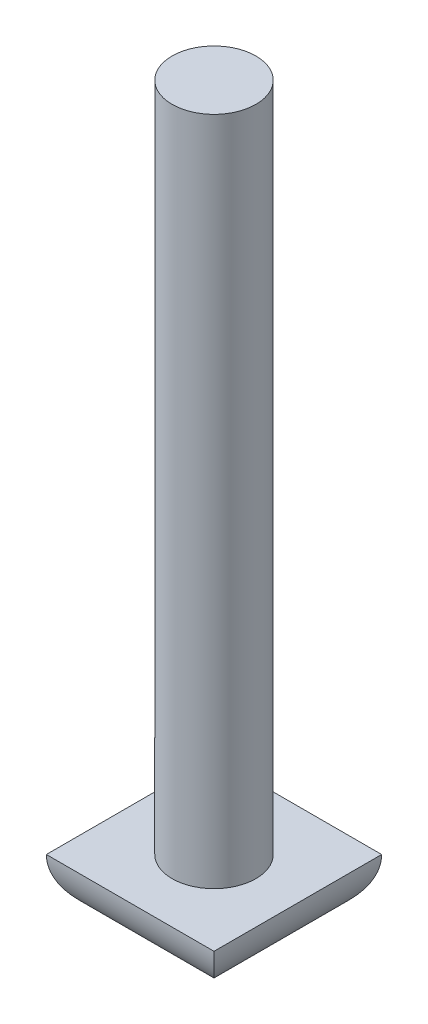
from build123d import *

# Parameters (mm, degrees)
SKETCH1_W           = 24
SKETCH1_H           = 24
BOSS_EXTRUDE1_DEPTH = 8
SKETCH2_R           = 6
BOSS_EXTRUDE2_DEPTH = 96
FILLET1_R           = 8


with BuildPart() as part:
    # Sketch1 → Boss-Extrude1 (new body)
    with BuildSketch(Plane(origin=(0, 0, 0), x_dir=(1, 0, 0), z_dir=(0, 1, 0))):
        Rectangle(SKETCH1_W, SKETCH1_H)
    extrude(amount=BOSS_EXTRUDE1_DEPTH)

    # Sketch2 → Boss-Extrude2 (add)
    with BuildSketch(Plane(origin=(0, 8, 0), x_dir=(1, 0, 0), z_dir=(0, 1, 0))):
        with Locations(Location((0, 0, 0), (0, 0, 90))):
            Circle(SKETCH2_R)
    extrude(amount=BOSS_EXTRUDE2_DEPTH)

    # Fillet1
    fillet1_edges = [part.edges().sort_by_distance(p)[0] for p in [
        (0, 0, 12),
        (12, 0, 0),
        (-12, 0, 0),
        (0, 0, -12),
    ]]
    fillet(fillet1_edges, radius=FILLET1_R - 0.0001)  # a hair under: the kernel refuses the full size


solid = part.part
